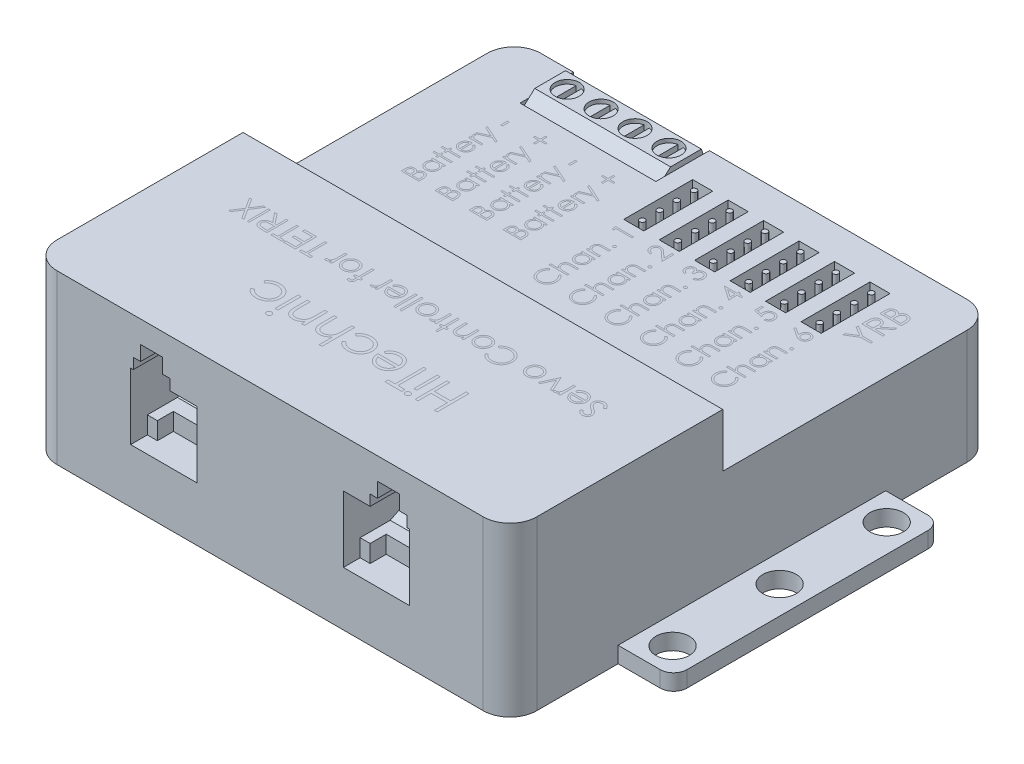
from build123d import *

# Parameters (mm, degrees)
BOSS_EXTRUDE1_DEPTH  = 35.85
SKETCH2_W            = 9.9
SKETCH2_H            = 9.9
CUT_EXTRUDE1_DEPTH   = 13
BOSS_EXTRUDE2_DEPTH  = 9.9
SKETCH3_3_W          = 2.4
SKETCH3_3_H          = 2.6
BOSS_EXTRUDE3_DEPTH  = 1.5
BOSS_EXTRUDE4_START  = 9.9
SKETCH3_4_W          = 2.4
SKETCH3_4_H          = 2.6
BOSS_EXTRUDE4_DEPTH  = 1.5
SKETCH4_W            = 20.3
SKETCH4_H            = 8
CUT_EXTRUDE2_DEPTH   = 9
BOSS_EXTRUDE5_DEPTH  = 20.3
SKETCH6_R            = 1.75
CUT_EXTRUDE3_DEPTH   = 6
CUT_EXTRUDE4_DEPTH   = 0.6
CUT_EXTRUDE5_DEPTH   = 2
SKETCH8_W            = 3
SKETCH8_H            = 10.3
SKETCH8_R            = 0.4
CUT_EXTRUDE6_DEPTH   = 4
SKETCH9_W            = 8.3
SKETCH9_H            = 40
SKETCH9_R            = 2.5
BOSS_EXTRUDE6_DEPTH  = 2.4
FILLET1_R            = 2
FILLET1_OF_MIRROR4_R = 2
FILLET2_R            = 4
SKETCH12_W           = 20.3
SKETCH12_H           = 8
BOSS_EXTRUDE7_DEPTH  = 9
LPATTERN1_COUNT      = 3
LPATTERN1_PITCH      = 10.6


with BuildPart() as part:
    # Sketch1 → Boss-Extrude1 (new, symmetric)
    with BuildSketch(Plane(origin=(0, 0, 0), x_dir=(0, 0, -1), z_dir=(1, 0, 0))):
        Polygon((-36.15, 0), (36.15, 0), (36.15, 17.1), (-4.35, 17.1), (-4.35, 25.1), (-36.15, 25.1), align=None)
    extrude(amount=BOSS_EXTRUDE1_DEPTH, both=True)

    # Sketch2 → Cut-Extrude1 (cut)
    with BuildSketch(Plane.XY.offset(36.15)):
        Polygon((14.95, 19.6), (14.95, 18), (20.45, 18), (20.45, 19.6), (19.35, 19.6), (19.35, 21.8), (16.05, 21.8), (16.05, 19.6), align=None)
        with Locations((15.9, 13.05)):
            Rectangle(SKETCH2_W, SKETCH2_H)
    cut_extrude1 = extrude(amount=-CUT_EXTRUDE1_DEPTH, mode=Mode.SUBTRACT)

    # Sketch3 → Boss-Extrude2 (add)
    with BuildSketch(Plane.ZY.offset(-20.85)):
        Polygon((23.15, 8.1), (31.25, 8.1), (31.25, 10.7), (29.15, 10.7), (24.35, 13.1), (24.35, 15.1), (23.15, 15.1), align=None)
    boss_extrude2 = extrude(amount=BOSS_EXTRUDE2_DEPTH)

    # Sketch3<3> → Boss-Extrude3 (add)
    with BuildSketch(Plane.ZY.offset(-20.85)):
        with Locations((32.45, 9.4)):
            Rectangle(SKETCH3_3_W, SKETCH3_3_H)
    boss_extrude3 = extrude(amount=BOSS_EXTRUDE3_DEPTH)

    # Sketch3<4> → Boss-Extrude4 (add)
    with BuildSketch(Plane.ZY.offset(-20.85).offset(BOSS_EXTRUDE4_START)):
        with Locations((32.45, 9.4)):
            Rectangle(SKETCH3_4_W, SKETCH3_4_H)
    boss_extrude4 = extrude(amount=-BOSS_EXTRUDE4_DEPTH)

    # Mirror1: Cut-Extrude1, Boss-Extrude2, Boss-Extrude3, Boss-Extrude4 across plane
    add(cut_extrude1.mirror(Plane(origin=(0, 0, 0), x_dir=(0, 0, 1), z_dir=(1, 0, 0))), mode=Mode.SUBTRACT)
    add(boss_extrude2.mirror(Plane(origin=(0, 0, 0), x_dir=(0, 0, 1), z_dir=(1, 0, 0))))
    add(boss_extrude3.mirror(Plane(origin=(0, 0, 0), x_dir=(0, 0, 1), z_dir=(1, 0, 0))))
    add(boss_extrude4.mirror(Plane(origin=(0, 0, 0), x_dir=(0, 0, 1), z_dir=(1, 0, 0))))

    # Sketch4 → Cut-Extrude2 (cut)
    with BuildSketch(Plane(origin=(0, 17.1, 0), x_dir=(1, 0, 0), z_dir=(0, 1, 0))):
        with Locations((16.8, 32.15)):
            Rectangle(SKETCH4_W, SKETCH4_H)
    cut_extrude2 = extrude(amount=-CUT_EXTRUDE2_DEPTH, mode=Mode.SUBTRACT)

    # Mirror2: Cut-Extrude2 across plane
    add(cut_extrude2.mirror(Plane(origin=(0, 0, 0), x_dir=(0, 0, 1), z_dir=(1, 0, 0))), mode=Mode.SUBTRACT)

    # Sketch8 → Cut-Extrude6 (cut)
    # profile 1 of 2: a face of its own
    with BuildSketch(Plane(origin=(0, 17.1, 0), x_dir=(1, 0, 0), z_dir=(0, 1, 0))):
        with Locations((-2.65, 26)):
            Rectangle(SKETCH8_W, SKETCH8_H)
        with Locations(Location((-2.65, 29.8625, 0), (0, 0, 270))):
            Circle(SKETCH8_R, mode=Mode.SUBTRACT)
        with Locations(Location((-2.65, 27.2875, 0), (0, 0, 270))):
            Circle(SKETCH8_R, mode=Mode.SUBTRACT)
        with Locations(Location((-2.65, 24.7125, 0), (0, 0, 270))):
            Circle(SKETCH8_R, mode=Mode.SUBTRACT)
        with Locations(Location((-2.65, 22.1375, 0), (0, 0, 270))):
            Circle(SKETCH8_R, mode=Mode.SUBTRACT)
    # profile 2 of 2: a face of its own
    with BuildSketch(Plane(origin=(0, 17.1, 0), x_dir=(1, 0, 0), z_dir=(0, 1, 0))):
        with Locations((2.65, 26)):
            Rectangle(SKETCH8_W, SKETCH8_H)
        with Locations(Location((2.65, 22.1375, 0), (0, 0, 270))):
            Circle(SKETCH8_R, mode=Mode.SUBTRACT)
        with Locations(Location((2.65, 24.7125, 0), (0, 0, 270))):
            Circle(SKETCH8_R, mode=Mode.SUBTRACT)
        with Locations(Location((2.65, 27.2875, 0), (0, 0, 270))):
            Circle(SKETCH8_R, mode=Mode.SUBTRACT)
        with Locations(Location((2.65, 29.8625, 0), (0, 0, 270))):
            Circle(SKETCH8_R, mode=Mode.SUBTRACT)
    cut_extrude6 = extrude(amount=-CUT_EXTRUDE6_DEPTH, mode=Mode.SUBTRACT)

    # Sketch9 → Boss-Extrude6 (add)
    with BuildSketch(Plane.XZ):
        with Locations((40, 0)):
            Rectangle(SKETCH9_W, SKETCH9_H)
        with Locations(Location((40, -16, 0), (0, 0, 270))):
            Circle(SKETCH9_R, mode=Mode.SUBTRACT)
        with Locations(Location((40, 0, 0), (0, 0, 270))):
            Circle(SKETCH9_R, mode=Mode.SUBTRACT)
        with Locations(Location((40, 16, 0), (0, 0, 270))):
            Circle(SKETCH9_R, mode=Mode.SUBTRACT)
    boss_extrude6 = extrude(amount=-BOSS_EXTRUDE6_DEPTH)

    # Fillet1
    fillet1_edges = [part.edges().sort_by_distance(p)[0] for p in [
        (44.15, 1.2, 20),
        (44.15, 1.2, -20),
    ]]
    fillet(fillet1_edges, radius=FILLET1_R)

    # Mirror4: Boss-Extrude6 across plane
    add(boss_extrude6.mirror(Plane(origin=(0, 0, 0), x_dir=(0, 0, 1), z_dir=(1, 0, 0))))

    # Fillet1 of Mirror4
    fillet1_of_mirror4_edges = [part.edges().sort_by_distance(p)[0] for p in [
        (-44.15, 1.2, 20),
        (-44.15, 1.2, -20),
    ]]
    fillet(fillet1_of_mirror4_edges, radius=FILLET1_OF_MIRROR4_R)

    # Fillet2
    fillet2_edges = [part.edges().sort_by_distance(p)[0] for p in [
        (-35.85, 12.55, 36.15),
        (35.85, 12.55, 36.15),
        (-35.85, 8.55, -36.15),
        (35.85, 8.55, -36.15),
    ]]
    fillet(fillet2_edges, radius=FILLET2_R)

    # Sketch12 → Boss-Extrude7 (add)
    with BuildSketch(Plane(origin=(0, 8.1, 0), x_dir=(1, 0, 0), z_dir=(0, 1, 0))):
        with Locations((16.8, 32.15)):
            Rectangle(SKETCH12_W, SKETCH12_H)
    extrude(amount=BOSS_EXTRUDE7_DEPTH)

    # LPattern1: Cut-Extrude6 ×3
    with Locations(*[(i * LPATTERN1_PITCH, 0, 0) for i in range(1, LPATTERN1_COUNT)]):
        add(cut_extrude6, mode=Mode.SUBTRACT)


with BuildPart() as body_2:
    # Sketch5 → Boss-Extrude5 (new body)
    with BuildSketch(Plane(origin=(6.65, 0, 0), x_dir=(0, 0, -1), z_dir=(1, 0, 0))):
        Polygon((36.15, 8.1), (36.15, 14.3), (34.95, 17.9), (30.35, 17.9), (28.15, 15.9), (28.15, 8.1), align=None)
    extrude(amount=BOSS_EXTRUDE5_DEPTH)

    # Sketch6 → Cut-Extrude3 (cut)
    with BuildSketch(Plane(origin=(0, 0, -36.15), x_dir=(-1, 0, 0), z_dir=(0, 0, -1))):
        with Locations((-24.4125, 11.2)):
            Circle(SKETCH6_R)
        with Locations((-19.3375, 11.2)):
            Circle(SKETCH6_R)
        with Locations((-14.2625, 11.2)):
            Circle(SKETCH6_R)
        with Locations((-9.1875, 11.2)):
            Circle(SKETCH6_R)
    extrude(amount=-CUT_EXTRUDE3_DEPTH, mode=Mode.SUBTRACT)

    # Sketch7 → Cut-Extrude4 (cut)
    with BuildSketch(Plane(origin=(0, 17.9, 0), x_dir=(1, 0, 0), z_dir=(0, 1, 0))):
        with BuildLine():
            ThreePointArc((10.9875, 32.65), (10.594624728, 33.772497216), (9.5875, 34.404992877))
            Line((9.5875, 34.404992877), (9.5875, 30.895007123))
            ThreePointArc((9.5875, 30.895007123), (10.594624728, 31.527502784), (10.9875, 32.65))
        make_face()
        with BuildLine():
            Line((8.7875, 30.895007123), (8.7875, 34.404992877))
            ThreePointArc((8.7875, 34.404992877), (7.3875, 32.65), (8.7875, 30.895007123))
        make_face()
        with BuildLine():
            Line((13.8625, 30.895007123), (13.8625, 34.404992877))
            ThreePointArc((13.8625, 34.404992877), (12.4625, 32.65), (13.8625, 30.895007123))
        make_face()
        with BuildLine():
            ThreePointArc((16.0625, 32.65), (15.669624728, 33.772497216), (14.6625, 34.404992877))
            Line((14.6625, 34.404992877), (14.6625, 30.895007123))
            ThreePointArc((14.6625, 30.895007123), (15.669624728, 31.527502784), (16.0625, 32.65))
        make_face()
        with BuildLine():
            ThreePointArc((18.9375, 34.404992877), (17.5375, 32.65), (18.9375, 30.895007123))
            Line((18.9375, 30.895007123), (18.9375, 34.404992877))
        make_face()
        with BuildLine():
            Line((19.7375, 34.404992877), (19.7375, 30.895007123))
            ThreePointArc((19.7375, 30.895007123), (20.744624728, 31.527502784), (21.1375, 32.65))
            ThreePointArc((21.1375, 32.65), (20.744624728, 33.772497216), (19.7375, 34.404992877))
        make_face()
        with BuildLine():
            Line((24.0125, 30.895007123), (24.0125, 34.404992877))
            ThreePointArc((24.0125, 34.404992877), (22.6125, 32.65), (24.0125, 30.895007123))
        make_face()
        with BuildLine():
            ThreePointArc((26.2125, 32.65), (25.819624728, 33.772497216), (24.8125, 34.404992877))
            Line((24.8125, 34.404992877), (24.8125, 30.895007123))
            ThreePointArc((24.8125, 30.895007123), (25.819624728, 31.527502784), (26.2125, 32.65))
        make_face()
    extrude(amount=-CUT_EXTRUDE4_DEPTH, mode=Mode.SUBTRACT)

    # Sketch7<3> → Cut-Extrude5 (cut)
    with BuildSketch(Plane(origin=(0, 17.9, 0), x_dir=(1, 0, 0), z_dir=(0, 1, 0))):
        with BuildLine():
            Line((24.8125, 30.895007123), (24.8125, 34.404992877))
            ThreePointArc((24.8125, 34.404992877), (24.4125, 34.45), (24.0125, 34.404992877))
            Line((24.0125, 34.404992877), (24.0125, 30.895007123))
            ThreePointArc((24.0125, 30.895007123), (24.4125, 30.85), (24.8125, 30.895007123))
        make_face()
        with BuildLine():
            Line((18.9375, 34.404992877), (18.9375, 30.895007123))
            ThreePointArc((18.9375, 30.895007123), (19.3375, 30.85), (19.7375, 30.895007123))
            Line((19.7375, 30.895007123), (19.7375, 34.404992877))
            ThreePointArc((19.7375, 34.404992877), (19.3375, 34.45), (18.9375, 34.404992877))
        make_face()
        with BuildLine():
            ThreePointArc((14.6625, 34.404992877), (14.2625, 34.45), (13.8625, 34.404992877))
            Line((13.8625, 34.404992877), (13.8625, 30.895007123))
            ThreePointArc((13.8625, 30.895007123), (14.2625, 30.85), (14.6625, 30.895007123))
            Line((14.6625, 30.895007123), (14.6625, 34.404992877))
        make_face()
        with BuildLine():
            ThreePointArc((9.5875, 34.404992877), (9.1875, 34.45), (8.7875, 34.404992877))
            Line((8.7875, 34.404992877), (8.7875, 30.895007123))
            ThreePointArc((8.7875, 30.895007123), (9.1875, 30.85), (9.5875, 30.895007123))
            Line((9.5875, 30.895007123), (9.5875, 34.404992877))
        make_face()
    extrude(amount=-CUT_EXTRUDE5_DEPTH, mode=Mode.SUBTRACT)


with BuildPart() as body_3:
    # Mirror3: mirrored copy
    add(body_2.part.mirror(Plane(origin=(0, 0, 0), x_dir=(0, 0, 1), z_dir=(1, 0, 0))))


solid = Compound([part.part, body_3.part])
